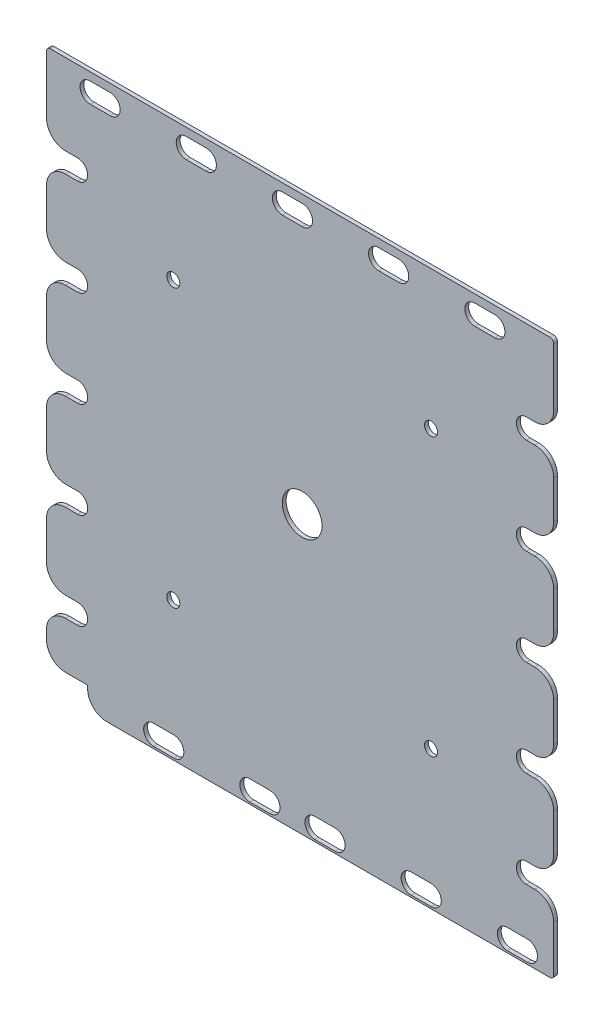
from build123d import *

# Parameters (mm, degrees)
SKETCH1_W               = 135.01974
SKETCH1_H               = 146.431289
SKETCH1_R               = 5.25
BOSS_EXTRUDE1_DEPTH     = 1.016
SKETCH3_W               = 1.1
SKETCH3_H               = 146.431289
CUT_EXTRUDE1_DEPTH      = 1.016
FILLET1_R               = 1
CUT_EXTRUDE2_DEPTH      = 199.438029157
CUT_EXTRUDE2_DEPTH_BACK = 199.438029157
SKETCH4_R               = 1.725
SKETCH4_W               = 2.90987194
SKETCH4_H               = 5.3
SKETCH4_W_2             = 10.8599
SKETCH4_H_2             = 5.825
FILLET2_R               = 5


with BuildPart() as part:
    # Sketch1 → Boss-Extrude1 (new body)
    with BuildSketch(Plane.XY):
        with Locations((67.50987, -73.2156445)):
            Rectangle(SKETCH1_W, SKETCH1_H)
        with BuildLine():
            Line((62.3049, -2.1125), (67.6049, -2.1125))
            ThreePointArc((67.6049, -2.1125), (70.2549, -4.7625), (67.6049, -7.4125))
            Line((67.6049, -7.4125), (62.3049, -7.4125))
            ThreePointArc((62.3049, -7.4125), (59.6549, -4.7625), (62.3049, -2.1125))
        make_face(mode=Mode.SUBTRACT)
        with Locations((67.50987, -73.2156445)):
            Circle(SKETCH1_R, mode=Mode.SUBTRACT)
        with BuildLine():
            Line((2.9099, -140.606289), (8.2099, -140.606289))
            ThreePointArc((8.2099, -140.606289), (10.8599, -143.256289), (8.2099, -145.906289))
            Line((8.2099, -145.906289), (2.9099, -145.906289))
            ThreePointArc((2.9099, -145.906289), (0.2599, -143.256289), (2.9099, -140.606289))
        make_face(mode=Mode.SUBTRACT)
        with BuildLine():
            Line((28.3099, -140.606289), (33.6099, -140.606289))
            ThreePointArc((33.6099, -140.606289), (36.2599, -143.256289), (33.6099, -145.906289))
            Line((33.6099, -145.906289), (28.3099, -145.906289))
            ThreePointArc((28.3099, -145.906289), (25.6599, -143.256289), (28.3099, -140.606289))
        make_face(mode=Mode.SUBTRACT)
        with BuildLine():
            Line((2.90987194, -122.953125), (8.20987194, -122.953125))
            ThreePointArc((8.20987194, -122.953125), (10.85987194, -125.603125), (8.20987194, -128.253125))
            Line((8.20987194, -128.253125), (2.90987194, -128.253125))
            ThreePointArc((2.90987194, -128.253125), (0.25987194, -125.603125), (2.90987194, -122.953125))
        make_face(mode=Mode.SUBTRACT)
        with BuildLine():
            Line((53.7099, -140.606289), (59.0099, -140.606289))
            ThreePointArc((59.0099, -140.606289), (61.6599, -143.256289), (59.0099, -145.906289))
            Line((59.0099, -145.906289), (53.7099, -145.906289))
            ThreePointArc((53.7099, -145.906289), (51.0599, -143.256289), (53.7099, -140.606289))
        make_face(mode=Mode.SUBTRACT)
        with BuildLine():
            Line((2.90987194, -97.553125), (8.20987194, -97.553125))
            ThreePointArc((8.20987194, -97.553125), (10.85987194, -100.203125), (8.20987194, -102.853125))
            Line((8.20987194, -102.853125), (2.90987194, -102.853125))
            ThreePointArc((2.90987194, -102.853125), (0.25987194, -100.203125), (2.90987194, -97.553125))
        make_face(mode=Mode.SUBTRACT)
        with BuildLine():
            Line((2.90987194, -72.153125), (8.20987194, -72.153125))
            ThreePointArc((8.20987194, -72.153125), (10.85987194, -74.803125), (8.20987194, -77.453125))
            Line((8.20987194, -77.453125), (2.90987194, -77.453125))
            ThreePointArc((2.90987194, -77.453125), (0.25987194, -74.803125), (2.90987194, -72.153125))
        make_face(mode=Mode.SUBTRACT)
        with BuildLine():
            Line((2.90987194, -46.753125), (8.20987194, -46.753125))
            ThreePointArc((8.20987194, -46.753125), (10.85987194, -49.403125), (8.20987194, -52.053125))
            Line((8.20987194, -52.053125), (2.90987194, -52.053125))
            ThreePointArc((2.90987194, -52.053125), (0.25987194, -49.403125), (2.90987194, -46.753125))
        make_face(mode=Mode.SUBTRACT)
        with BuildLine():
            Line((2.90987194, -21.353125), (8.20987194, -21.353125))
            ThreePointArc((8.20987194, -21.353125), (10.85987194, -24.003125), (8.20987194, -26.653125))
            Line((8.20987194, -26.653125), (2.90987194, -26.653125))
            ThreePointArc((2.90987194, -26.653125), (0.25987194, -24.003125), (2.90987194, -21.353125))
        make_face(mode=Mode.SUBTRACT)
        with BuildLine():
            Line((11.5049, -2.1125), (16.8049, -2.1125))
            ThreePointArc((16.8049, -2.1125), (19.4549, -4.7625), (16.8049, -7.4125))
            Line((16.8049, -7.4125), (11.5049, -7.4125))
            ThreePointArc((11.5049, -7.4125), (8.8549, -4.7625), (11.5049, -2.1125))
        make_face(mode=Mode.SUBTRACT)
        with BuildLine():
            Line((36.9049, -2.1125), (42.2049, -2.1125))
            ThreePointArc((42.2049, -2.1125), (44.8549, -4.7625), (42.2049, -7.4125))
            Line((42.2049, -7.4125), (36.9049, -7.4125))
            ThreePointArc((36.9049, -7.4125), (34.2549, -4.7625), (36.9049, -2.1125))
        make_face(mode=Mode.SUBTRACT)
        with BuildLine():
            Line((118.4049, -7.4125), (113.1049, -7.4125))
            ThreePointArc((113.1049, -7.4125), (110.4549, -4.7625), (113.1049, -2.1125))
            Line((113.1049, -2.1125), (118.4049, -2.1125))
            ThreePointArc((118.4049, -2.1125), (121.0549, -4.7625), (118.4049, -7.4125))
        make_face(mode=Mode.SUBTRACT)
        with BuildLine():
            Line((76.20003, -145.906289), (70.90003, -145.906289))
            ThreePointArc((70.90003, -145.906289), (68.25003, -143.256289), (70.90003, -140.606289))
            Line((70.90003, -140.606289), (76.20003, -140.606289))
            ThreePointArc((76.20003, -140.606289), (78.85003, -143.256289), (76.20003, -145.906289))
        make_face(mode=Mode.SUBTRACT)
        with BuildLine():
            Line((96.30003, -140.606289), (101.60003, -140.606289))
            ThreePointArc((101.60003, -140.606289), (104.25003, -143.256289), (101.60003, -145.906289))
            Line((101.60003, -145.906289), (96.30003, -145.906289))
            ThreePointArc((96.30003, -145.906289), (93.65003, -143.256289), (96.30003, -140.606289))
        make_face(mode=Mode.SUBTRACT)
        with BuildLine():
            Line((121.70003, -140.606289), (127.00003, -140.606289))
            ThreePointArc((127.00003, -140.606289), (129.65003, -143.256289), (127.00003, -145.906289))
            Line((127.00003, -145.906289), (121.70003, -145.906289))
            ThreePointArc((121.70003, -145.906289), (119.05003, -143.256289), (121.70003, -140.606289))
        make_face(mode=Mode.SUBTRACT)
        with BuildLine():
            Line((126.734872, -122.953125), (132.034872, -122.953125))
            ThreePointArc((132.034872, -122.953125), (134.684872, -125.603125), (132.034872, -128.253125))
            Line((132.034872, -128.253125), (126.734872, -128.253125))
            ThreePointArc((126.734872, -128.253125), (124.084872, -125.603125), (126.734872, -122.953125))
        make_face(mode=Mode.SUBTRACT)
        with BuildLine():
            Line((126.734872, -97.553125), (132.034872, -97.553125))
            ThreePointArc((132.034872, -97.553125), (134.684872, -100.203125), (132.034872, -102.853125))
            Line((132.034872, -102.853125), (126.734872, -102.853125))
            ThreePointArc((126.734872, -102.853125), (124.084872, -100.203125), (126.734872, -97.553125))
        make_face(mode=Mode.SUBTRACT)
        with BuildLine():
            Line((126.734872, -72.153125), (132.034872, -72.153125))
            ThreePointArc((132.034872, -72.153125), (134.684872, -74.803125), (132.034872, -77.453125))
            Line((132.034872, -77.453125), (126.734872, -77.453125))
            ThreePointArc((126.734872, -77.453125), (124.084872, -74.803125), (126.734872, -72.153125))
        make_face(mode=Mode.SUBTRACT)
        with BuildLine():
            Line((126.734872, -46.753125), (132.034872, -46.753125))
            ThreePointArc((132.034872, -46.753125), (134.684872, -49.403125), (132.034872, -52.053125))
            Line((132.034872, -52.053125), (126.734872, -52.053125))
            ThreePointArc((126.734872, -52.053125), (124.084872, -49.403125), (126.734872, -46.753125))
        make_face(mode=Mode.SUBTRACT)
        with BuildLine():
            Line((87.7049, -2.1125), (93.0049, -2.1125))
            ThreePointArc((93.0049, -2.1125), (95.6549, -4.7625), (93.0049, -7.4125))
            Line((93.0049, -7.4125), (87.7049, -7.4125))
            ThreePointArc((87.7049, -7.4125), (85.0549, -4.7625), (87.7049, -2.1125))
        make_face(mode=Mode.SUBTRACT)
        with BuildLine():
            Line((126.734872, -21.353125), (132.034872, -21.353125))
            ThreePointArc((132.034872, -21.353125), (134.684872, -24.003125), (132.034872, -26.653125))
            Line((132.034872, -26.653125), (126.734872, -26.653125))
            ThreePointArc((126.734872, -26.653125), (124.084872, -24.003125), (126.734872, -21.353125))
        make_face(mode=Mode.SUBTRACT)
    extrude(amount=BOSS_EXTRUDE1_DEPTH)

    # Sketch3 → Cut-Extrude1 (cut)
    with BuildSketch(Plane.XY.offset(1.016)):
        with Locations((134.46974, -73.2156445)):
            Rectangle(SKETCH3_W, SKETCH3_H)
    extrude(amount=-CUT_EXTRUDE1_DEPTH, mode=Mode.SUBTRACT)

    # Fillet1
    fillet1_edges = [part.edges().sort_by_distance(p)[0] for p in [
        (0, -146.431289, 0.508),
        (0, 0, 0.508),
        (133.91974, 0, 0.508),
        (133.91974, -146.431289, 0.508),
    ]]
    fillet(fillet1_edges, radius=FILLET1_R)

    # Sketch4 → Cut-Extrude2 (cut, two sides: drawn at the far end of the back side and taken through both)
    with BuildSketch(Plane.XY.offset(1.016).offset(-CUT_EXTRUDE2_DEPTH_BACK)):
        with Locations((33.479935, -36.60782225)):
            Circle(SKETCH4_R)
        with Locations((101.539805, -36.60782225)):
            Circle(SKETCH4_R)
        with Locations((101.539805, -109.82346675)):
            Circle(SKETCH4_R)
        with Locations((33.479935, -109.82346675)):
            Circle(SKETCH4_R)
        with Locations((1.45493597, -24.003125)):
            Rectangle(SKETCH4_W, SKETCH4_H)
        with Locations((1.45493597, -49.403125)):
            Rectangle(SKETCH4_W, SKETCH4_H)
        with Locations((1.45493597, -74.803125)):
            Rectangle(SKETCH4_W, SKETCH4_H)
        with Locations((1.45493597, -100.203125)):
            Rectangle(SKETCH4_W, SKETCH4_H)
        with Locations((1.45493597, -125.603125)):
            Rectangle(SKETCH4_W, SKETCH4_H)
        with Locations((5.42995, -143.518789)):
            Rectangle(SKETCH4_W_2, SKETCH4_H_2)
    extrude(amount=CUT_EXTRUDE2_DEPTH + CUT_EXTRUDE2_DEPTH_BACK, mode=Mode.SUBTRACT)

    # Fillet2
    # the kernel refuses this fillet: 5 mm, written as the material it takes off along each edge
    with BuildSketch(Plane(origin=(133.91974, -22.140392431, 15.484168578), x_dir=(-0.9878300229479848, 0.1555372809412071, 0), z_dir=(0, 0, -1))) as fillet2_piece_1:
        with BuildLine():
            CenterArc((5.839285955, 4.939150115), FILLET2_R, 171.052041894, 90)
            Line((0.90013584, 5.716836519), (0.406220829, 5.79460516))
            Line((0.406220829, 5.79460516), (-0.493915011, 0.07776864))
            Line((-0.493915011, 0.07776864), (0.296642423, -0.402496302))
            ThreePointArc((0.296642423, -0.402496302), (1.906609995, -0.00939585), (4.98383091, -0.493915011))
            Line((4.98383091, -0.493915011), (5.06159955, 0))
        make_face()
    extrude(amount=29.952337156, mode=Mode.SUBTRACT)
    with BuildSketch(Plane(origin=(133.91974, -25.865857569, 15.484168578), x_dir=(-0.987830022947984, -0.1555372809412105, 0), z_dir=(0, 0, -1)), Plane(origin=(133.91974, -51.265857569, 15.484168578), x_dir=(-0.9878300229479876, -0.1555372809411893, 0), z_dir=(0, 0, -1)), Plane(origin=(133.91974, -76.665857569, 15.484168578), x_dir=(-0.9878300229479883, -0.15553728094118519, 0), z_dir=(0, 0, -1)), Plane(origin=(133.91974, -102.065857569, 15.484168578), x_dir=(-0.9878300229479912, -0.155537280941166, 0), z_dir=(0, 0, -1)), Plane(origin=(133.91974, -127.465857569, 15.484168578), x_dir=(-0.9878300229479929, -0.15553728094115504, 0), z_dir=(0, 0, -1))) as fillet2_piece_2:
        with BuildLine():
            CenterArc((5.839285955, -4.939150115), FILLET2_R, 98.947958106, 90)
            Line((0.90013584, -5.716836519), (0.406220829, -5.79460516))
            Line((0.406220829, -5.79460516), (-0.493915011, -0.07776864))
            Line((-0.493915011, -0.07776864), (0.296642423, 0.402496302))
            ThreePointArc((0.296642423, 0.402496302), (1.906609995, 0.00939585), (4.98383091, 0.493915011))
            Line((4.98383091, 0.493915011), (5.06159955, 0))
        make_face()
    extrude(amount=29.952337156, mode=Mode.SUBTRACT)
    with BuildSketch(Plane(origin=(133.91974, -47.540392431, 15.484168578), x_dir=(0, 1, 0), z_dir=(0, 0, -1)), Plane(origin=(133.91974, -72.940392431, 15.484168578), x_dir=(0, 1, 0), z_dir=(0, 0, -1)), Plane(origin=(133.91974, -98.340392431, 15.484168578), x_dir=(0, 1, 0), z_dir=(0, 0, -1)), Plane(origin=(133.91974, -123.740392431, 15.484168578), x_dir=(0, 1, 0), z_dir=(0, 0, -1))) as fillet2_piece_3:
        with BuildLine():
            CenterArc((5.787267431, -5), FILLET2_R, 90, 90)
            Line((0.787267431, -5), (0.287267431, -5))
            ThreePointArc((0.287267431, -5), (0.287267431, -1.884868), (-0.351458975, -0.355635472))
            Line((-0.351458975, -0.355635472), (0, 0.5))
            Line((0, 0.5), (5.787267431, 0.5))
            Line((5.787267431, 0.5), (5.787267431, 0))
        make_face()
    extrude(amount=29.952337156, mode=Mode.SUBTRACT)
    with BuildSketch(Plane(origin=(0, -140.606289, -12.5), x_dir=(1, 0, 0), z_dir=(0, 0, 1)), Plane(origin=(0, -26.653125, -12.5), x_dir=(0, -1, 0), z_dir=(0, 0, 1)), Plane(origin=(0, -21.353125, -12.5), x_dir=(1, 0, 0), z_dir=(0, 0, 1)), Plane(origin=(0, -46.753125, -12.5), x_dir=(1, 0, 0), z_dir=(0, 0, 1)), Plane(origin=(0, -72.153125, -12.5), x_dir=(1, 0, 0), z_dir=(0, 0, 1)), Plane(origin=(0, -97.553125, -12.5), x_dir=(1, 0, 0), z_dir=(0, 0, 1)), Plane(origin=(0, -122.953125, -12.5), x_dir=(1, 0, 0), z_dir=(0, 0, 1))) as fillet2_piece_4:
        with BuildLine():
            CenterArc((FILLET2_R, FILLET2_R), FILLET2_R, 180, 90)
            Line((0, FILLET2_R), (0, 0))
            Line((0, 0), (FILLET2_R, 0))
        make_face()
    extrude(amount=26.016, mode=Mode.SUBTRACT)
    with BuildSketch(Plane(origin=(10.8599, -146.431289, 13.516), x_dir=(1, 0, 0), z_dir=(0, 0, -1)), Plane(origin=(0, -52.053125, 13.516), x_dir=(0, -1, 0), z_dir=(0, 0, -1)), Plane(origin=(0, -77.453125, 13.516), x_dir=(0, -1, 0), z_dir=(0, 0, -1)), Plane(origin=(0, -102.853125, 13.516), x_dir=(0, -1, 0), z_dir=(0, 0, -1)), Plane(origin=(0, -128.253125, 13.516), x_dir=(0, -1, 0), z_dir=(0, 0, -1))) as fillet2_piece_5:
        with BuildLine():
            CenterArc((FILLET2_R, -FILLET2_R), FILLET2_R, 90, 90)
            Line((0, -FILLET2_R), (0, 0))
            Line((0, 0), (FILLET2_R, 0))
        make_face()
    extrude(amount=26.016, mode=Mode.SUBTRACT)


solid = part.part
